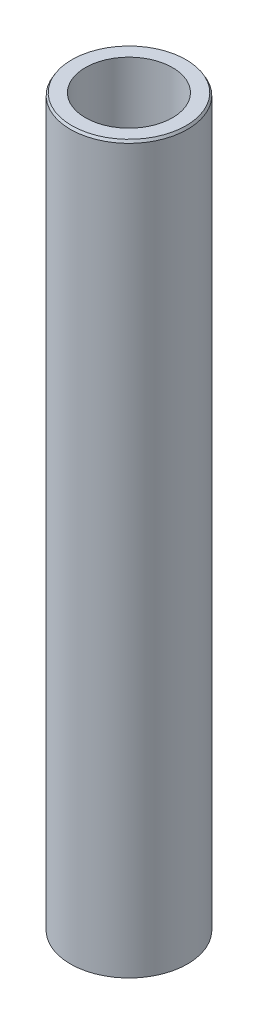
from build123d import *
from OCP.BRepFilletAPI import BRepFilletAPI_MakeChamfer

# Parameters (mm, degrees)
SKETCH1_R           = 27.5
BOSS_EXTRUDE1_DEPTH = 341.118441085
SKETCH2_R           = 20.430993177
CUT_EXTRUDE1_DEPTH  = 344.328255243
CHAMFER1_SIZE       = 1.170367478
CHAMFER1_SIZE2      = 0.675711978


with BuildPart() as part:
    # Sketch1 → Boss-Extrude1 (new body)
    with BuildSketch(Plane(origin=(0, 0, 0), x_dir=(1, 0, 0), z_dir=(0, 1, 0))):
        Circle(SKETCH1_R)
    extrude(amount=BOSS_EXTRUDE1_DEPTH)

    # Sketch2 → Cut-Extrude1 (cut, through all)
    with BuildSketch(Plane(origin=(0, 0, 0), x_dir=(1, 0, 0), z_dir=(0, 1, 0))):
        Circle(SKETCH2_R)
    extrude(amount=CUT_EXTRUDE1_DEPTH, mode=Mode.SUBTRACT)

    # Chamfer1: one chamfer whose edges measure the first distance from different faces: ONE call of the kernel's chamfer builder (chamfer() names one face for all edges)
    chamfer1_edges_1 = [part.edges().sort_by_distance(p)[0] for p in [
        (-27.5, 341.118441085, 0),
    ]]
    chamfer1_side_1 = [part.faces().sort_by_distance(p)[0] for p in [
        (-27.5, 170.559220543, 0),
    ]]
    chamfer1_edges_2 = [part.edges().sort_by_distance(p)[0] for p in [
        (-27.5, 0, 0),
    ]]
    chamfer1_side_2 = [part.faces().sort_by_distance(p)[0] for p in [
        (-26.722182541, 0, 0),
    ]]
    chamfer1 = BRepFilletAPI_MakeChamfer(part.part.solid().wrapped)
    for e in chamfer1_edges_1:
        chamfer1.Add(CHAMFER1_SIZE, CHAMFER1_SIZE2, e.wrapped, chamfer1_side_1[0].wrapped)  # the first distance lies on this face
    for e in chamfer1_edges_2:
        chamfer1.Add(CHAMFER1_SIZE, CHAMFER1_SIZE2, e.wrapped, chamfer1_side_2[0].wrapped)  # the first distance lies on this face
    add(Compound.cast(chamfer1.Shape()), mode=Mode.REPLACE)


solid = part.part
